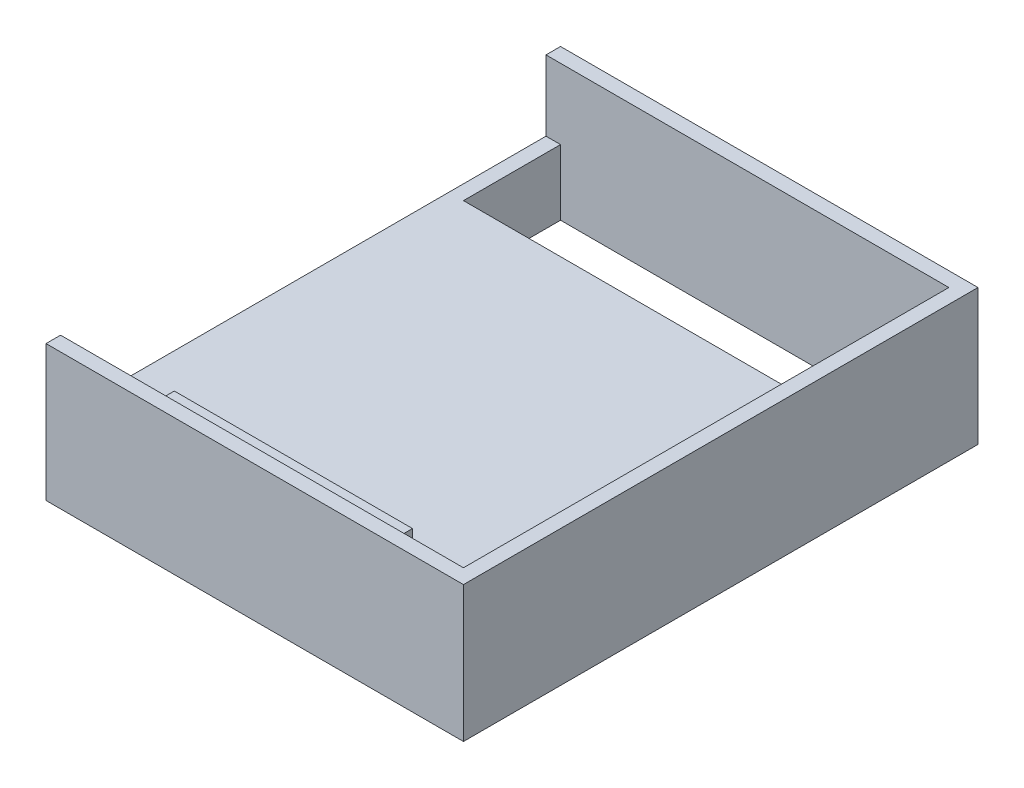
from build123d import *

# Parameters (mm, degrees)
SKETCH_1_W            = 34.4
SKETCH_1_H            = 42.4
EXTRUDE_1_DEPTH       = 7
SKETCH_2_W            = 33.2
SKETCH_2_H            = 40
CUT_EXTRUDE_1_DEPTH   = 5.8
SKETCH_3_W            = 34.4
SKETCH_3_H            = 42.4
EXTRUDE_2_DEPTH       = 4.2
SKETCH_4_W            = 32
SKETCH_4_H            = 40
CUT_EXTRUDE_2_DEPTH   = 4.2
SKETCH_5_W            = 32
SKETCH_5_H            = 8
CUT_EXTRUDE_941_DEPTH = 1.2
EXTRUDE_3_DEPTH       = 4.5


with BuildPart() as part:
    # 草图1 → 凸台-拉伸1 (new body)
    with BuildSketch(Plane(origin=(0, 0, 0), x_dir=(1, 0, 0), z_dir=(0, 1, 0))):
        with Locations((17.2, 21.2)):
            Rectangle(SKETCH_1_W, SKETCH_1_H)
    extrude(amount=EXTRUDE_1_DEPTH)

    # 草图2 → 切除-拉伸1 (cut)
    with BuildSketch(Plane(origin=(0, 7, 0), x_dir=(1, 0, 0), z_dir=(0, 1, 0))):
        with Locations((16.6, 21.2)):
            Rectangle(SKETCH_2_W, SKETCH_2_H)
    extrude(amount=-CUT_EXTRUDE_1_DEPTH, mode=Mode.SUBTRACT)

    # 草图3 → 凸台-拉伸2 (add)
    with BuildSketch(Plane.XZ):
        with Locations((17.2, -21.2)):
            Rectangle(SKETCH_3_W, SKETCH_3_H)
    extrude(amount=EXTRUDE_2_DEPTH)

    # 草图4 → 切除-拉伸2 (cut)
    with BuildSketch(Plane.XZ.offset(4.2)):
        with Locations((17.2, -21.2)):
            Rectangle(SKETCH_4_W, SKETCH_4_H)
    extrude(amount=-CUT_EXTRUDE_2_DEPTH, mode=Mode.SUBTRACT)

    # 草图5 → Cut-Extrude 941 (cut)
    with BuildSketch(Plane.XZ):
        with Locations((17.2, -37.2)):
            Rectangle(SKETCH_5_W, SKETCH_5_H)
    extrude(amount=-CUT_EXTRUDE_941_DEPTH, mode=Mode.SUBTRACT)

    # 草图6 → 凸台-拉伸3 (add)
    with BuildSketch(Plane(origin=(0, 1.2, 0), x_dir=(1, 0, 0), z_dir=(0, 1, 0))):
        Polygon((17.2, 1.2), (7.372652868, 1.2), (7.372652868, 3.2), (27, 3.2), (27, 1.2), align=None)
    extrude(amount=EXTRUDE_3_DEPTH)


solid = part.part
